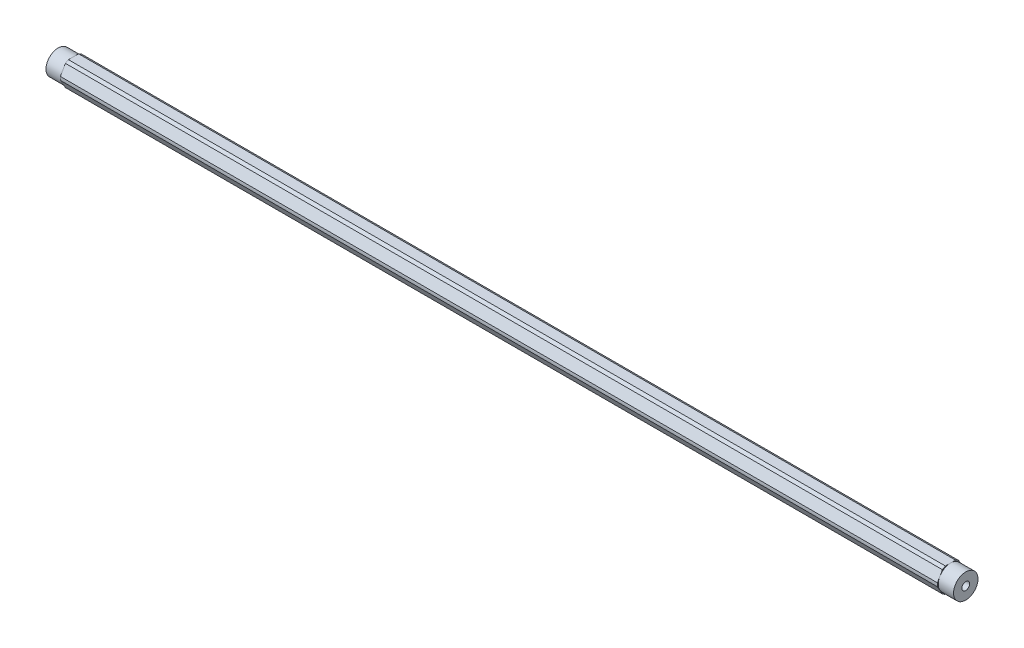
from build123d import *

# Parameters (mm, degrees)
SKETCH1_R               = 2.0193
BOSS_EXTRUDE1_DEPTH     = 235.74375
SKETCH2_R               = 8.89
SKETCH2_R_2             = 6.35
CUT_EXTRUDE_THIN1_DEPTH = 7.9375


with BuildPart() as part:
    # Sketch1 → Boss-Extrude1 (new, symmetric)
    with BuildSketch(Plane(origin=(0, 0, 0), x_dir=(0, 0, -1), z_dir=(1, 0, 0))):
        with BuildLine():
            ThreePointArc((4.181770846, 5.456960429), (3.437499983, 5.953924622), (2.634980936, 6.35))
            Line((2.634980936, 6.35), (-2.634980936, 6.35))
            ThreePointArc((-2.634980936, 6.35), (-3.437499983, 5.953924622), (-4.181770846, 5.456960429))
            Line((-4.181770846, 5.456960429), (-6.816751782, 0.893039571))
            ThreePointArc((-6.816751782, 0.893039571), (-6.874999966, 0), (-6.816751782, -0.893039571))
            Line((-6.816751782, -0.893039571), (-4.181770846, -5.456960429))
            ThreePointArc((-4.181770846, -5.456960429), (-3.437499983, -5.953924622), (-2.634980936, -6.35))
            Line((-2.634980936, -6.35), (2.634980936, -6.35))
            ThreePointArc((2.634980936, -6.35), (3.437499983, -5.953924622), (4.181770846, -5.456960429))
            Line((4.181770846, -5.456960429), (6.816751782, -0.893039571))
            ThreePointArc((6.816751782, -0.893039571), (6.860422465, -0.447468582), (6.874999966, 0))
            ThreePointArc((6.874999966, 0), (6.860422465, 0.447468582), (6.816751782, 0.893039571))
            Line((6.816751782, 0.893039571), (4.181770846, 5.456960429))
        make_face()
        Circle(SKETCH1_R, mode=Mode.SUBTRACT)
    extrude(amount=BOSS_EXTRUDE1_DEPTH, both=True)

    # Sketch2 → Cut-Extrude-Thin1 (cut)
    with BuildSketch(Plane(origin=(235.74375, 0, 0), x_dir=(0, 0, -1), z_dir=(1, 0, 0))):
        Circle(SKETCH2_R)
        Circle(SKETCH2_R_2, mode=Mode.SUBTRACT)
    cut_extrude_thin1 = extrude(amount=-CUT_EXTRUDE_THIN1_DEPTH, mode=Mode.SUBTRACT)

    # Mirror1: Cut-Extrude-Thin1 across plane
    add(cut_extrude_thin1.mirror(Plane(origin=(0, 0, 0), x_dir=(0, 0, 1), z_dir=(1, 0, 0))), mode=Mode.SUBTRACT)


solid = part.part
